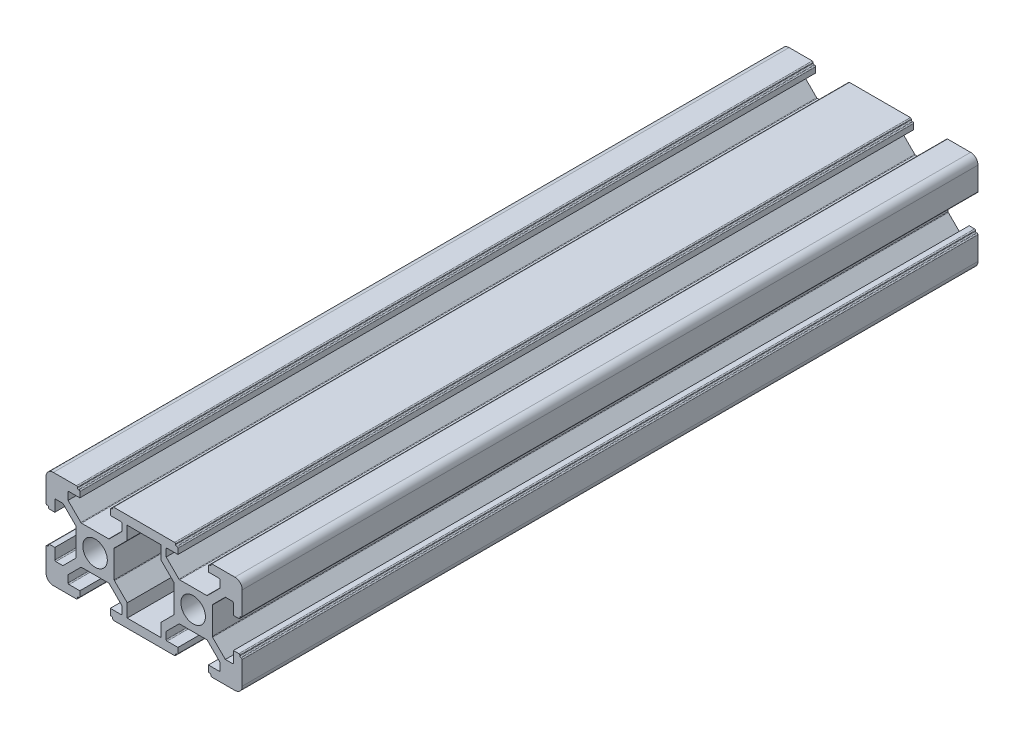
from build123d import *

# Parameters (mm, degrees)
BOSS_EXTRUDE1_DEPTH = 150
SKETCH2_R           = 2.5
CUT_EXTRUDE1_DEPTH  = 154.297097168
SKETCH3_R           = 1.5
CUT_EXTRUDE2_DEPTH  = 65


with BuildPart() as part:
    # Sketch1 → Boss-Extrude1 (new body)
    with BuildSketch(Plane.XY):
        with BuildLine():
            Line((-8.5, 10), (-3.8, 10))
            ThreePointArc((-3.8, 10), (-3.658578644, 9.941421356), (-3.6, 9.8))
            Line((-3.6, 9.8), (-3.6, 9.7))
            ThreePointArc((-3.6, 9.7), (-3.541421356, 9.558578644), (-3.4, 9.5))
            Line((-3.4, 9.5), (-3.3, 9.5))
            ThreePointArc((-3.3, 9.5), (-3.158578644, 9.441421356), (-3.1, 9.3))
            Line((-3.1, 9.3), (-3.1, 8.2))
            Line((-3.1, 8.2), (-5.3, 8.2))
            ThreePointArc((-5.3, 8.2), (-5.441421356, 8.141421356), (-5.5, 8))
            Line((-5.5, 8), (-5.5, 6.560660172))
            Line((-5.5, 6.560660172), (-2.897918472, 3.958578644))
            ThreePointArc((-2.897918472, 3.958578644), (-2.833033802, 3.915224093), (-2.756497116, 3.9))
            Line((-2.756497116, 3.9), (2.756497116, 3.9))
            ThreePointArc((2.756497116, 3.9), (2.833033802, 3.915224093), (2.897918472, 3.958578644))
            Line((2.897918472, 3.958578644), (5.5, 6.560660172))
            Line((5.5, 6.560660172), (5.5, 8))
            ThreePointArc((5.5, 8), (5.441421356, 8.141421356), (5.3, 8.2))
            Line((5.3, 8.2), (3.1, 8.2))
            Line((3.1, 8.2), (3.1, 9.3))
            ThreePointArc((3.1, 9.3), (3.158578644, 9.441421356), (3.3, 9.5))
            Line((3.3, 9.5), (3.4, 9.5))
            ThreePointArc((3.4, 9.5), (3.541421356, 9.558578644), (3.6, 9.7))
            Line((3.6, 9.7), (3.6, 9.8))
            ThreePointArc((3.6, 9.8), (3.658578644, 9.941421356), (3.8, 10))
            Line((3.8, 10), (8.5, 10))
            Line((8.5, 10), (11.5, 10))
            Line((11.5, 10), (16.2, 10))
            ThreePointArc((16.2, 10), (16.341421356, 9.941421356), (16.4, 9.8))
            Line((16.4, 9.8), (16.4, 9.7))
            ThreePointArc((16.4, 9.7), (16.458578644, 9.558578644), (16.6, 9.5))
            Line((16.6, 9.5), (16.7, 9.5))
            ThreePointArc((16.7, 9.5), (16.841421356, 9.441421356), (16.9, 9.3))
            Line((16.9, 9.3), (16.9, 8.2))
            Line((16.9, 8.2), (14.7, 8.2))
            ThreePointArc((14.7, 8.2), (14.558578644, 8.141421356), (14.5, 8))
            Line((14.5, 8), (14.5, 6.560660172))
            Line((14.5, 6.560660172), (17.102081528, 3.958578644))
            ThreePointArc((17.102081528, 3.958578644), (17.166966198, 3.915224093), (17.243502884, 3.9))
            Line((17.243502884, 3.9), (22.756497116, 3.9))
            ThreePointArc((22.756497116, 3.9), (22.833033802, 3.915224093), (22.897918472, 3.958578644))
            Line((22.897918472, 3.958578644), (25.5, 6.560660172))
            Line((25.5, 6.560660172), (25.5, 8))
            ThreePointArc((25.5, 8), (25.441421356, 8.141421356), (25.3, 8.2))
            Line((25.3, 8.2), (23.1, 8.2))
            Line((23.1, 8.2), (23.1, 9.3))
            ThreePointArc((23.1, 9.3), (23.158578644, 9.441421356), (23.3, 9.5))
            Line((23.3, 9.5), (23.4, 9.5))
            ThreePointArc((23.4, 9.5), (23.541421356, 9.558578644), (23.6, 9.7))
            Line((23.6, 9.7), (23.6, 9.8))
            ThreePointArc((23.6, 9.8), (23.658578644, 9.941421356), (23.8, 10))
            Line((23.8, 10), (28.5, 10))
            ThreePointArc((28.5, 10), (29.560660172, 9.560660172), (30, 8.5))
            Line((30, 8.5), (30, 3.8))
            ThreePointArc((30, 3.8), (29.941421356, 3.658578644), (29.8, 3.6))
            Line((29.8, 3.6), (29.7, 3.6))
            ThreePointArc((29.7, 3.6), (29.558578644, 3.541421356), (29.5, 3.4))
            Line((29.5, 3.4), (29.5, 3.3))
            ThreePointArc((29.5, 3.3), (29.441421356, 3.158578644), (29.3, 3.1))
            Line((29.3, 3.1), (28.2, 3.1))
            Line((28.2, 3.1), (28.2, 5.3))
            ThreePointArc((28.2, 5.3), (28.141421356, 5.441421356), (28, 5.5))
            Line((28, 5.5), (26.560660172, 5.5))
            Line((26.560660172, 5.5), (23.958578644, 2.897918472))
            ThreePointArc((23.958578644, 2.897918472), (23.915224093, 2.833033802), (23.9, 2.756497116))
            Line((23.9, 2.756497116), (23.9, -2.756497116))
            ThreePointArc((23.9, -2.756497116), (23.915224093, -2.833033802), (23.958578644, -2.897918472))
            Line((23.958578644, -2.897918472), (26.560660172, -5.5))
            Line((26.560660172, -5.5), (28, -5.5))
            ThreePointArc((28, -5.5), (28.141421356, -5.441421356), (28.2, -5.3))
            Line((28.2, -5.3), (28.2, -3.1))
            Line((28.2, -3.1), (29.3, -3.1))
            ThreePointArc((29.3, -3.1), (29.441421356, -3.158578644), (29.5, -3.3))
            Line((29.5, -3.3), (29.5, -3.4))
            ThreePointArc((29.5, -3.4), (29.558578644, -3.541421356), (29.7, -3.6))
            Line((29.7, -3.6), (29.8, -3.6))
            ThreePointArc((29.8, -3.6), (29.941421356, -3.658578644), (30, -3.8))
            Line((30, -3.8), (30, -8.5))
            ThreePointArc((30, -8.5), (29.560660172, -9.560660172), (28.5, -10))
            Line((28.5, -10), (23.8, -10))
            ThreePointArc((23.8, -10), (23.658578644, -9.941421356), (23.6, -9.8))
            Line((23.6, -9.8), (23.6, -9.7))
            ThreePointArc((23.6, -9.7), (23.541421356, -9.558578644), (23.4, -9.5))
            Line((23.4, -9.5), (23.3, -9.5))
            ThreePointArc((23.3, -9.5), (23.158578644, -9.441421356), (23.1, -9.3))
            Line((23.1, -9.3), (23.1, -8.2))
            Line((23.1, -8.2), (25.3, -8.2))
            ThreePointArc((25.3, -8.2), (25.441421356, -8.141421356), (25.5, -8))
            Line((25.5, -8), (25.5, -6.560660172))
            Line((25.5, -6.560660172), (22.897918472, -3.958578644))
            ThreePointArc((22.897918472, -3.958578644), (22.833033802, -3.915224093), (22.756497116, -3.9))
            Line((22.756497116, -3.9), (17.243502884, -3.9))
            ThreePointArc((17.243502884, -3.9), (17.166966198, -3.915224093), (17.102081528, -3.958578644))
            Line((17.102081528, -3.958578644), (14.5, -6.560660172))
            Line((14.5, -6.560660172), (14.5, -8))
            ThreePointArc((14.5, -8), (14.558578644, -8.141421356), (14.7, -8.2))
            Line((14.7, -8.2), (16.9, -8.2))
            Line((16.9, -8.2), (16.9, -9.3))
            ThreePointArc((16.9, -9.3), (16.841421356, -9.441421356), (16.7, -9.5))
            Line((16.7, -9.5), (16.6, -9.5))
            ThreePointArc((16.6, -9.5), (16.458578644, -9.558578644), (16.4, -9.7))
            Line((16.4, -9.7), (16.4, -9.8))
            ThreePointArc((16.4, -9.8), (16.341421356, -9.941421356), (16.2, -10))
            Line((16.2, -10), (11.5, -10))
            Line((11.5, -10), (8.5, -10))
            Line((8.5, -10), (3.8, -10))
            ThreePointArc((3.8, -10), (3.658578644, -9.941421356), (3.6, -9.8))
            Line((3.6, -9.8), (3.6, -9.7))
            ThreePointArc((3.6, -9.7), (3.541421356, -9.558578644), (3.4, -9.5))
            Line((3.4, -9.5), (3.3, -9.5))
            ThreePointArc((3.3, -9.5), (3.158578644, -9.441421356), (3.1, -9.3))
            Line((3.1, -9.3), (3.1, -8.2))
            Line((3.1, -8.2), (5.3, -8.2))
            ThreePointArc((5.3, -8.2), (5.441421356, -8.141421356), (5.5, -8))
            Line((5.5, -8), (5.5, -6.560660172))
            Line((5.5, -6.560660172), (2.897918472, -3.958578644))
            ThreePointArc((2.897918472, -3.958578644), (2.833033802, -3.915224093), (2.756497116, -3.9))
            Line((2.756497116, -3.9), (-2.756497116, -3.9))
            ThreePointArc((-2.756497116, -3.9), (-2.833033802, -3.915224093), (-2.897918472, -3.958578644))
            Line((-2.897918472, -3.958578644), (-5.5, -6.560660172))
            Line((-5.5, -6.560660172), (-5.5, -8))
            ThreePointArc((-5.5, -8), (-5.441421356, -8.141421356), (-5.3, -8.2))
            Line((-5.3, -8.2), (-3.1, -8.2))
            Line((-3.1, -8.2), (-3.1, -9.3))
            ThreePointArc((-3.1, -9.3), (-3.158578644, -9.441421356), (-3.3, -9.5))
            Line((-3.3, -9.5), (-3.4, -9.5))
            ThreePointArc((-3.4, -9.5), (-3.541421356, -9.558578644), (-3.6, -9.7))
            Line((-3.6, -9.7), (-3.6, -9.8))
            ThreePointArc((-3.6, -9.8), (-3.658578644, -9.941421356), (-3.8, -10))
            Line((-3.8, -10), (-8.5, -10))
            ThreePointArc((-8.5, -10), (-9.560660172, -9.560660172), (-10, -8.5))
            Line((-10, -8.5), (-10, -3.8))
            ThreePointArc((-10, -3.8), (-9.941421356, -3.658578644), (-9.8, -3.6))
            Line((-9.8, -3.6), (-9.7, -3.6))
            ThreePointArc((-9.7, -3.6), (-9.558578644, -3.541421356), (-9.5, -3.4))
            Line((-9.5, -3.4), (-9.5, -3.3))
            ThreePointArc((-9.5, -3.3), (-9.441421356, -3.158578644), (-9.3, -3.1))
            Line((-9.3, -3.1), (-8.2, -3.1))
            Line((-8.2, -3.1), (-8.2, -5.3))
            ThreePointArc((-8.2, -5.3), (-8.141421356, -5.441421356), (-8, -5.5))
            Line((-8, -5.5), (-6.560660172, -5.5))
            Line((-6.560660172, -5.5), (-3.958578644, -2.897918472))
            ThreePointArc((-3.958578644, -2.897918472), (-3.915224093, -2.833033802), (-3.9, -2.756497116))
            Line((-3.9, -2.756497116), (-3.9, 2.756497116))
            ThreePointArc((-3.9, 2.756497116), (-3.915224093, 2.833033802), (-3.958578644, 2.897918472))
            Line((-3.958578644, 2.897918472), (-6.560660172, 5.5))
            Line((-6.560660172, 5.5), (-8, 5.5))
            ThreePointArc((-8, 5.5), (-8.141421356, 5.441421356), (-8.2, 5.3))
            Line((-8.2, 5.3), (-8.2, 3.1))
            Line((-8.2, 3.1), (-9.3, 3.1))
            ThreePointArc((-9.3, 3.1), (-9.441421356, 3.158578644), (-9.5, 3.3))
            Line((-9.5, 3.3), (-9.5, 3.4))
            ThreePointArc((-9.5, 3.4), (-9.558578644, 3.541421356), (-9.7, 3.6))
            Line((-9.7, 3.6), (-9.8, 3.6))
            ThreePointArc((-9.8, 3.6), (-9.941421356, 3.658578644), (-10, 3.8))
            Line((-10, 3.8), (-10, 8.5))
            ThreePointArc((-10, 8.5), (-9.560660172, 9.560660172), (-8.5, 10))
        make_face()
        with BuildLine():
            Line((3.9, 2.756497116), (3.9, -2.756497116))
            ThreePointArc((3.9, -2.756497116), (3.915224093, -2.833033802), (3.958578644, -2.897918472))
            Line((3.958578644, -2.897918472), (6.560660172, -5.5))
            Line((6.560660172, -5.5), (6.560660172, -8.2))
            Line((6.560660172, -8.2), (13.439339828, -8.2))
            Line((13.439339828, -8.2), (13.439339828, -5.5))
            Line((13.439339828, -5.5), (16.041421356, -2.897918472))
            ThreePointArc((16.041421356, -2.897918472), (16.084775907, -2.833033802), (16.1, -2.756497116))
            Line((16.1, -2.756497116), (16.1, 2.756497116))
            ThreePointArc((16.1, 2.756497116), (16.084775907, 2.833033802), (16.041421356, 2.897918472))
            Line((16.041421356, 2.897918472), (13.439339828, 5.5))
            Line((13.439339828, 5.5), (13.439339828, 8.2))
            Line((13.439339828, 8.2), (6.560660172, 8.2))
            Line((6.560660172, 8.2), (6.560660172, 5.5))
            Line((6.560660172, 5.5), (3.958578644, 2.897918472))
            ThreePointArc((3.958578644, 2.897918472), (3.915224093, 2.833033802), (3.9, 2.756497116))
        make_face(mode=Mode.SUBTRACT)
    extrude(amount=BOSS_EXTRUDE1_DEPTH)

    # Sketch2 → Cut-Extrude1 (cut, through all)
    with BuildSketch(Plane.XY.offset(150)):
        Circle(SKETCH2_R)
        with Locations((20, 0)):
            Circle(SKETCH2_R)
    extrude(amount=-CUT_EXTRUDE1_DEPTH, mode=Mode.SUBTRACT)

    # Sketch3 → Cut-Extrude2 (cut)
    with BuildSketch(Plane(origin=(23.9, 0, 0), x_dir=(0, 0, -1), z_dir=(1, 0, 0))):
        with Locations((-133.3, 0)):
            Circle(SKETCH3_R)
        with Locations((-116.6, 0)):
            Circle(SKETCH3_R)
    extrude(amount=-CUT_EXTRUDE2_DEPTH, mode=Mode.SUBTRACT)


solid = part.part
